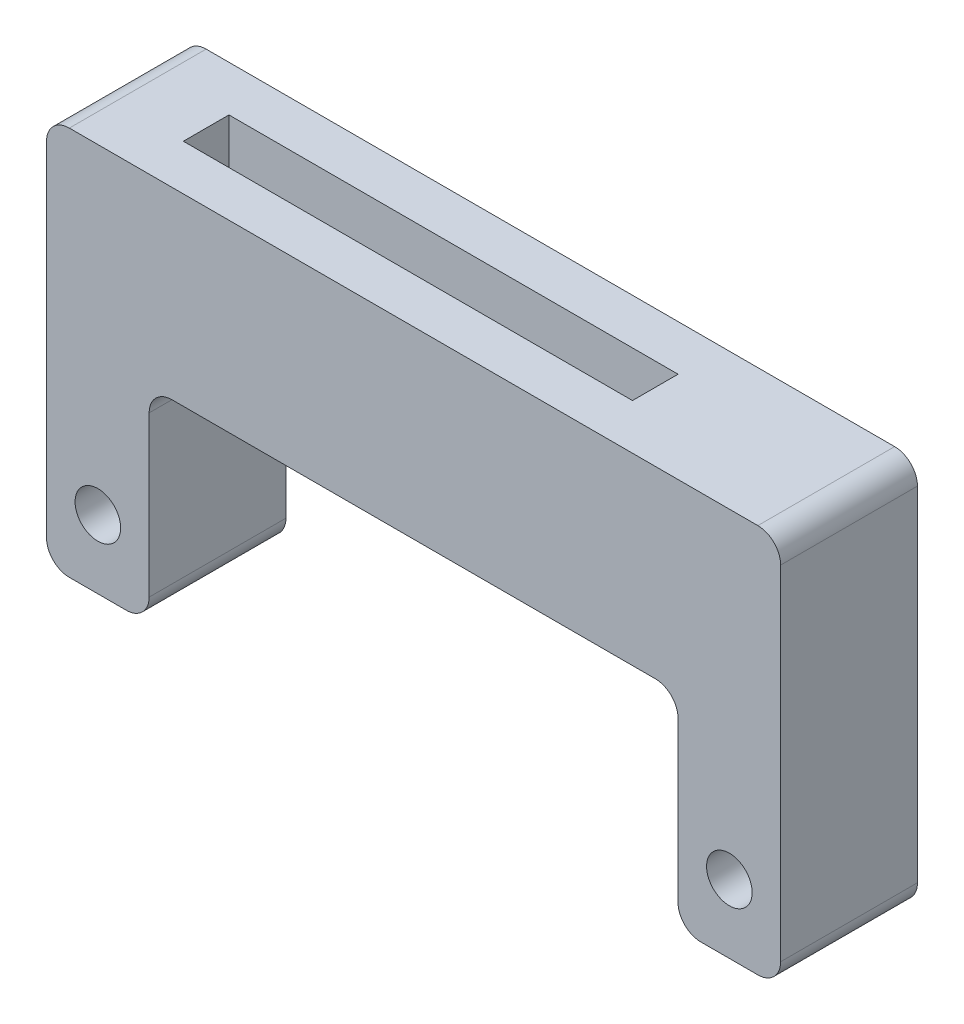
from build123d import *

# Parameters (mm, degrees)
SKETCH2_W           = 32.2
SKETCH2_H           = 17.068
BOSS_EXTRUDE1_DEPTH = 3
SKETCH3_W           = 19.7
SKETCH3_H           = 2
CUT_EXTRUDE1_DEPTH  = 2.5
SKETCH4_W           = 23.2
SKETCH4_H           = 9
CUT_EXTRUDE2_DEPTH  = 20.18434664
SKETCH5_R           = 1
CUT_EXTRUDE3_DEPTH  = 20.18434664
FILLET1_R           = 1


with BuildPart() as part:
    # Sketch2 → Boss-Extrude1 (new, symmetric)
    with BuildSketch(Plane.XY):
        Rectangle(SKETCH2_W, SKETCH2_H)
    extrude(amount=BOSS_EXTRUDE1_DEPTH, both=True)

    # Sketch3 → Cut-Extrude1 (cut)
    with BuildSketch(Plane(origin=(0, 8.534, 0), x_dir=(1, 0, 0), z_dir=(0, 1, 0))):
        with Locations((-2.25, 0)):
            Rectangle(SKETCH3_W, SKETCH3_H)
    extrude(amount=-CUT_EXTRUDE1_DEPTH, mode=Mode.SUBTRACT)

    # Sketch4 → Cut-Extrude2 (cut, through all)
    with BuildSketch(Plane.XY.offset(3)):
        with Locations((0, -4.034)):
            Rectangle(SKETCH4_W, SKETCH4_H)
    extrude(amount=-CUT_EXTRUDE2_DEPTH, mode=Mode.SUBTRACT)

    # Sketch5 → Cut-Extrude3 (cut, through all)
    with BuildSketch(Plane.XY.offset(3)):
        with Locations((-13.85, -5.534)):
            Circle(SKETCH5_R)
        with Locations((13.85, -5.534)):
            Circle(SKETCH5_R)
    extrude(amount=-CUT_EXTRUDE3_DEPTH, mode=Mode.SUBTRACT)

    # Fillet1
    fillet1_edges = [part.edges().sort_by_distance(p)[0] for p in [
        (16.1, 8.534, 0),
        (16.1, -8.534, 0),
        (11.6, -8.534, 0),
        (11.6, 0.466, 0),
        (-11.6, 0.466, 0),
        (-11.6, -8.534, 0),
        (-16.1, -8.534, 0),
        (-16.1, 8.534, 0),
    ]]
    fillet(fillet1_edges, radius=FILLET1_R)


solid = part.part
